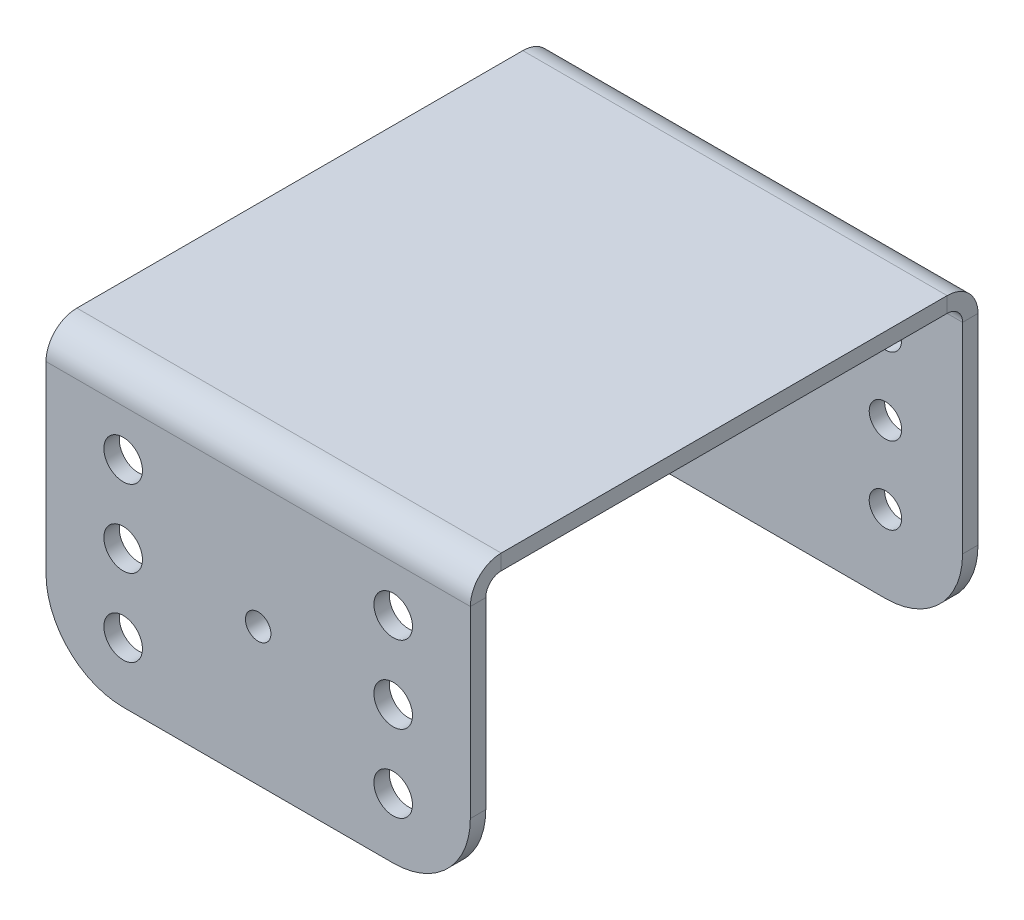
from build123d import *

# Parameters (mm, degrees)
SKETCH_1_R                       = 2.1
SM_BASE_FLANGE_1_DEPTH           = 2
SM_EDGE_FLANGE_1_STRIP_W         = 12
SM_EDGE_FLANGE_1_STRIP_H         = 2
SM_EDGE_FLANGE_1_STRIP_CUT_DEPTH = 55
SM_EDGE_FLANGE_1_DEPTH           = 55
SM_EDGE_FLANGE_2_STRIP_W         = 12
SM_EDGE_FLANGE_2_STRIP_H         = 2
SM_EDGE_FLANGE_2_STRIP_CUT_DEPTH = 55
SM_EDGE_FLANGE_2_DEPTH           = 55
SM_EDGE_FLANGE_2_PROFILE_R       = 2.5
SM_EDGE_FLANGE_2_FLAT_DEPTH      = 2
SKETCH_12_R                      = 3
EXTRUDE_1_DEPTH                  = 2
HOLE_WIZARD_M4_1_D               = 3.3
HOLE_WIZARD_M4_1_DEPTH           = 6
HOLE_WIZARD_M4_1_TIP             = 0.991420021


# Sheet-metal steps are written as plain solids
with BuildPart() as part:
    # Sketch 1 → 基体-法兰1 (new body)
    with BuildSketch(Plane.XY):
        with BuildLine():
            Line((-27.5, 20), (27.5, 20))
            Line((27.5, 20), (27.5, -10))
            ThreePointArc((27.5, -10), (24.571067812, -17.071067812), (17.5, -20))
            Line((17.5, -20), (-17.5, -20))
            ThreePointArc((-17.5, -20), (-24.571067812, -17.071067812), (-27.5, -10))
            Line((-27.5, -10), (-27.5, 20))
        make_face()
        with Locations((-17.5, 10)):
            Circle(SKETCH_1_R, mode=Mode.SUBTRACT)
        with Locations(Location((17.5, 10, 0), (0, 0, 180))):
            Circle(SKETCH_1_R, mode=Mode.SUBTRACT)
        with Locations((17.5, -10)):
            Circle(SKETCH_1_R, mode=Mode.SUBTRACT)
        with Locations(Location((-17.5, -10, 0), (0, 0, 180))):
            Circle(SKETCH_1_R, mode=Mode.SUBTRACT)
        with Locations((-17.5, 0)):
            Circle(SKETCH_1_R, mode=Mode.SUBTRACT)
        with Locations((17.5, 0)):
            Circle(SKETCH_1_R, mode=Mode.SUBTRACT)
    extrude(amount=-SM_BASE_FLANGE_1_DEPTH)

    # 边线-法兰1 strip (across the edge) → 边线-法兰1 strip cut (cut)
    with BuildSketch(Plane(origin=(27.5, 20, 0), x_dir=(0, -1, 0), z_dir=(-1, 0, 0))):
        with Locations((-2, -1)):
            Rectangle(SM_EDGE_FLANGE_1_STRIP_W, SM_EDGE_FLANGE_1_STRIP_H)
    extrude(amount=SM_EDGE_FLANGE_1_STRIP_CUT_DEPTH, mode=Mode.SUBTRACT)

    # 边线-法兰1 section (across the edge) → 边线-法兰1 (add)
    with BuildSketch(Plane(origin=(27.5, 20, 0), x_dir=(0, -1, 0), z_dir=(-1, 0, 0))):
        with BuildLine():
            Line((0, 2), (0, 63.8))
            Line((0, 63.8), (2, 63.8))
            Line((2, 63.8), (2, 2))
            ThreePointArc((2, 2), (2.585786438, 0.585786438), (4, 0))
            Line((4, 0), (4, -2))
            ThreePointArc((4, -2), (1.171572875, -0.828427125), (0, 2))
        make_face()
    extrude(amount=SM_EDGE_FLANGE_1_DEPTH)

    # 边线-法兰2 strip (across the edge) → 边线-法兰2 strip cut (cut)
    with BuildSketch(Plane(origin=(27.5, 18, 63.8), x_dir=(0, 0, -1), z_dir=(-1, 0, 0))):
        with Locations((-2, -1)):
            Rectangle(SM_EDGE_FLANGE_2_STRIP_W, SM_EDGE_FLANGE_2_STRIP_H)
    extrude(amount=SM_EDGE_FLANGE_2_STRIP_CUT_DEPTH, mode=Mode.SUBTRACT)

    # 边线-法兰2 bend section (across the edge) → 边线-法兰2 (add)
    with BuildSketch(Plane(origin=(27.5, 18, 63.8), x_dir=(0, 0, -1), z_dir=(-1, 0, 0))):
        with BuildLine():
            Line((0, 2), (2, 2))
            ThreePointArc((2, 2), (2.585786438, 0.585786438), (4, 0))
            Line((4, 0), (4, -2))
            ThreePointArc((4, -2), (1.171572875, -0.828427125), (0, 2))
        make_face()
    extrude(amount=SM_EDGE_FLANGE_2_DEPTH)

    # 边线-法兰2 profile (on flange) → 边线-法兰2 flat (add)
    with BuildSketch(Plane(origin=(0, 18, 63.8), x_dir=(-1, 0, 0), z_dir=(0, 0, 1))):
        with BuildLine():
            Line((-27.5, 2), (27.5, 2))
            Line((27.5, 2), (27.5, 25.8))
            ThreePointArc((27.5, 25.8), (24.571067812, 32.871067812), (17.5, 35.8))
            Line((17.5, 35.8), (-17.5, 35.8))
            ThreePointArc((-17.5, 35.8), (-24.571067812, 32.871067812), (-27.5, 25.8))
            Line((-27.5, 25.8), (-27.5, 2))
        make_face()
        with Locations((17.5, 8)):
            Circle(SM_EDGE_FLANGE_2_PROFILE_R, mode=Mode.SUBTRACT)
        with Locations((17.5, 18)):
            Circle(SM_EDGE_FLANGE_2_PROFILE_R, mode=Mode.SUBTRACT)
        with Locations((-17.5, 8)):
            Circle(SM_EDGE_FLANGE_2_PROFILE_R, mode=Mode.SUBTRACT)
        with Locations((-17.5, 18)):
            Circle(SM_EDGE_FLANGE_2_PROFILE_R, mode=Mode.SUBTRACT)
        with Locations((17.5, 28)):
            Circle(SM_EDGE_FLANGE_2_PROFILE_R, mode=Mode.SUBTRACT)
        with Locations((-17.5, 28)):
            Circle(SM_EDGE_FLANGE_2_PROFILE_R, mode=Mode.SUBTRACT)
    extrude(amount=-SM_EDGE_FLANGE_2_FLAT_DEPTH)

    # 草图12 → 凸台-拉伸1 (add)
    with BuildSketch(Plane(origin=(0, 0, 61.8), x_dir=(-1, 0, 0), z_dir=(0, 0, -1))):
        with Locations(Location((0, 0, 0), (0, 0, 270))):
            Circle(SKETCH_12_R)
    extrude(amount=EXTRUDE_1_DEPTH)

    # M4 螺纹孔1
    with Locations(Plane.XY.offset(63.8)):
        with Locations((0, 0)):
            Hole(HOLE_WIZARD_M4_1_D / 2, depth=HOLE_WIZARD_M4_1_DEPTH)
            with Locations((0, 0, -(HOLE_WIZARD_M4_1_DEPTH + HOLE_WIZARD_M4_1_TIP / 2))):  # 118° drill point
                Cone(0, HOLE_WIZARD_M4_1_D / 2, HOLE_WIZARD_M4_1_TIP, mode=Mode.SUBTRACT)


solid = part.part
